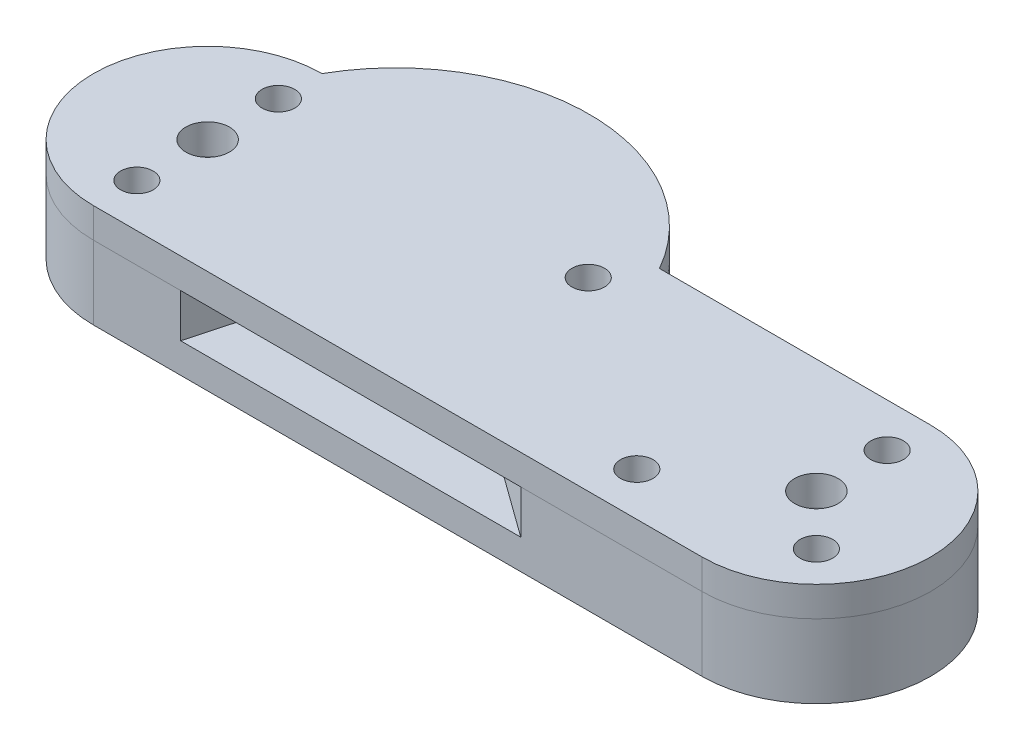
from build123d import *

# Parameters (mm, degrees)
SKETCH1_R                       = 2
BOSS_EXTRUDE1_DEPTH             = 4.75
CUT_EXTRUDE1_DEPTH              = 2
BOSS_EXTRUDE2_REACH             = 69.423
BOSS_EXTRUDE2_DIRECTION_2_REACH = 69.423
CUT_EXTRUDE2_DEPTH              = 2
SKETCH7_R                       = 1.5
CUT_EXTRUDE3_DEPTH              = 70.897349716
SKETCH8_R                       = 2.75
CUT_EXTRUDE4_DEPTH              = 3.2


with BuildPart() as part:
    # Sketch1 → Boss-Extrude1 (new, symmetric)
    with BuildSketch(Plane(origin=(0, 0, 0), x_dir=(1, 0, 0), z_dir=(0, 1, 0))):
        with BuildLine():
            Line((0, -10.500399217), (-55.93053828, -10.500399217))
            ThreePointArc((-55.93053828, -10.500399217), (-66.430937497, 0), (-55.93053828, 10.500399217))
            Line((-55.93053828, 10.500399217), (0, 10.500399217))
            ThreePointArc((0, 10.500399217), (10.500399217, 0), (0, -10.500399217))
        make_face()
        Circle(SKETCH1_R, mode=Mode.SUBTRACT)
        with Locations((-55.93053828, 0)):
            Circle(SKETCH1_R, mode=Mode.SUBTRACT)
    extrude(amount=BOSS_EXTRUDE1_DEPTH, both=True)

    # Sketch3 → Cut-Extrude1 (cut, symmetric)
    with BuildSketch(Plane(origin=(0, 0, 0), x_dir=(1, 0, 0), z_dir=(0, 1, 0))):
        with BuildLine():
            Line((-35.751827911, 18.875253657), (-39.299525946, 5.868950542))
            Line((-39.299525946, 5.868950542), (26.645239155, -41.810424095))
            ThreePointArc((26.645239155, -41.810424095), (-18.563858299, -45.972421055), (-48.206523525, -11.584965354))
            Line((-48.206523525, -11.584965354), (-43.887265107, 4.249974277))
            Line((-43.887265107, 4.249974277), (-54.812276631, 12.148974547))
            ThreePointArc((-54.812276631, 12.148974547), (-46.585078234, 19.204535889), (-35.751827911, 18.875253657))
        make_face()
    extrude(amount=CUT_EXTRUDE1_DEPTH, both=True, mode=Mode.SUBTRACT)

    # Boss-Extrude2: up to this face of the body (flat: up to its plane)
    boss_extrude2_end = Plane(part.part.faces().sort_by_distance((-27.96526914, 4.75, 0))[0])
    # Sketch5 → Boss-Extrude2 (add, up to the picked face)
    with BuildSketch(Plane(origin=(0, 0, 0), x_dir=(1, 0, 0), z_dir=(0, 1, 0)), mode=Mode.PRIVATE) as boss_extrude2_sk1:
        with BuildLine():
            ThreePointArc((-24.917700351, 10.500399217), (-40.424119316, 19.553005923), (-55.93053828, 10.500399217))
            Line((-55.93053828, 10.500399217), (-24.917700351, 10.500399217))
        make_face()
    boss_extrude2_tool1 = split(extrude(boss_extrude2_sk1.sketch, amount=BOSS_EXTRUDE2_REACH, mode=Mode.PRIVATE), bisect_by=boss_extrude2_end, keep=Keep.BOTH, mode=Mode.PRIVATE)
    add(boss_extrude2_tool1.solids().sort_by(Axis((-40.424119, 0, -14.214125), (0, 1, 0)))[0])

    # Boss-Extrude2 direction 2: up to this face of the body (flat: up to its plane)
    boss_extrude2_direction_2_end = Plane(part.part.faces().sort_by_distance((-27.96526914, -4.75, 0))[0])
    # Sketch5 → Boss-Extrude2 direction 2 (add, up to the picked face)
    with BuildSketch(Plane(origin=(0, 0, 0), x_dir=(1, 0, 0), z_dir=(0, 1, 0)), mode=Mode.PRIVATE) as boss_extrude2_direction_2_sk1:
        with BuildLine():
            ThreePointArc((-24.917700351, 10.500399217), (-40.424119316, 19.553005923), (-55.93053828, 10.500399217))
            Line((-55.93053828, 10.500399217), (-24.917700351, 10.500399217))
        make_face()
    boss_extrude2_direction_2_tool1 = split(extrude(boss_extrude2_direction_2_sk1.sketch, amount=-BOSS_EXTRUDE2_DIRECTION_2_REACH, mode=Mode.PRIVATE), bisect_by=boss_extrude2_direction_2_end, keep=Keep.BOTH, mode=Mode.PRIVATE)
    add(boss_extrude2_direction_2_tool1.solids().sort_by(Axis((-40.424119, 0, -14.214125), (0, -1, 0)))[0])

    # Sketch6 → Cut-Extrude2 (cut, symmetric)
    with BuildSketch(Plane(origin=(0, 0, 0), x_dir=(1, 0, 0), z_dir=(0, 1, 0))):
        with BuildLine():
            Line((-39.299525946, 5.868950542), (-16.659276721, -10.500399217))
            Line((-16.659276721, -10.500399217), (-47.910689027, -10.500399217))
            Line((-47.910689027, -10.500399217), (-43.887265107, 4.249974277))
            Line((-43.887265107, 4.249974277), (-54.854382526, 12.179417945))
            ThreePointArc((-54.854382526, 12.179417945), (-46.349897212, 18.538096729), (-35.738154791, 18.925381021))
            Line((-35.738154791, 18.925381021), (-39.299525946, 5.868950542))
        make_face()
    extrude(amount=CUT_EXTRUDE2_DEPTH, both=True, mode=Mode.SUBTRACT)

    # Sketch7 → Cut-Extrude3 (cut, through all)
    with BuildSketch(Plane.XZ.offset(4.75)):
        with Locations((-27.461551073, -6.500399217)):
            Circle(SKETCH7_R)
        with Locations((0, -6.500399217)):
            Circle(SKETCH7_R)
        with Locations((4.596476366, 4.596476366)):
            Circle(SKETCH7_R)
        with Locations((-10, 6.500399217)):
            Circle(SKETCH7_R)
        with Locations((-55.93053828, 6.500399217)):
            Circle(SKETCH7_R)
        with Locations((-55.93053828, -6.500399217)):
            Circle(SKETCH7_R)
    extrude(amount=-CUT_EXTRUDE3_DEPTH, mode=Mode.SUBTRACT)

    # Sketch8 → Cut-Extrude4 (cut)
    with BuildSketch(Plane.XZ.offset(4.75)):
        with Locations((-55.93053828, 6.500399217)):
            Circle(SKETCH8_R)
        with Locations((-55.93053828, -6.500399217)):
            Circle(SKETCH8_R)
        with Locations((-27.461551073, -6.500399217)):
            Circle(SKETCH8_R)
        with Locations((-10, 6.500399217)):
            Circle(SKETCH8_R)
        with Locations((4.596476366, 4.596476366)):
            Circle(SKETCH8_R)
        with Locations((0, -6.500399217)):
            Circle(SKETCH8_R)
    extrude(amount=-CUT_EXTRUDE4_DEPTH, mode=Mode.SUBTRACT)


with BuildPart() as body_2:
    # Split1: the piece on the far side of the plane
    add(part.part)
    split(bisect_by=Plane(origin=(0, 2, 0), x_dir=(0, 0, -1), z_dir=(0, -1, 0)), keep=Keep.BOTTOM)


with BuildPart() as part_1:
    add(part.part)

    # Split1
    split(bisect_by=Plane(origin=(0, 2, 0), x_dir=(0, 0, -1), z_dir=(0, -1, 0)), keep=Keep.TOP)


solid = Compound([body_2.part, part_1.part])
